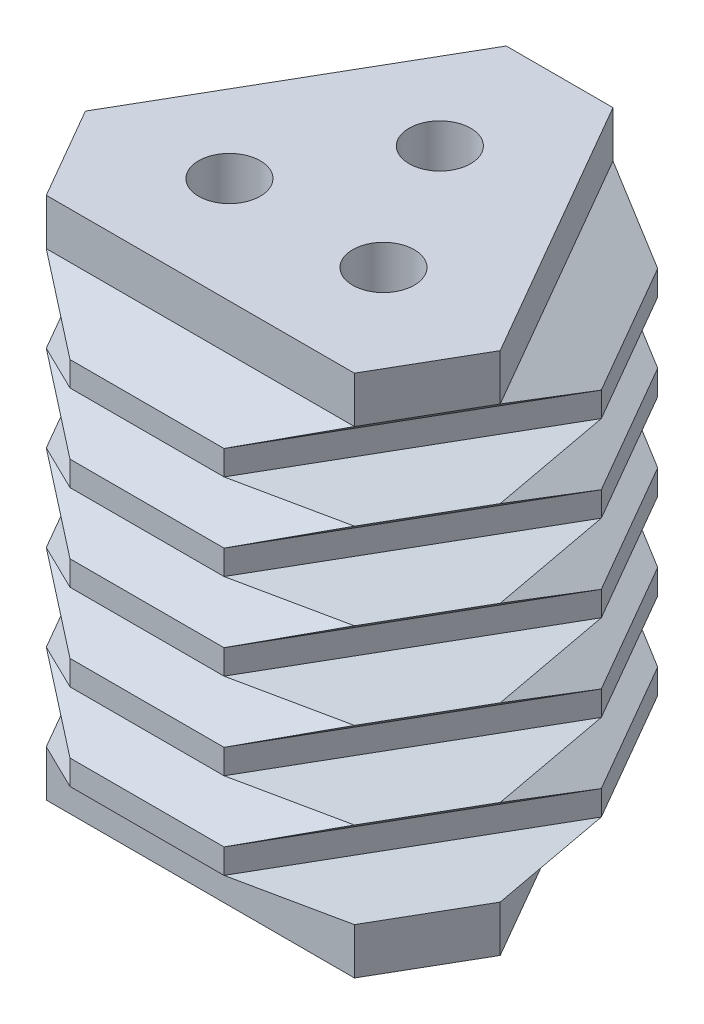
from build123d import *

# Parameters (mm, degrees)
SKETCH19_W           = 5
SKETCH19_H           = 2
BOSS_EXTRUDE2_DEPTH  = 0.8
SKETCH47_W           = 2
SKETCH47_H           = 0.8
BOSS_EXTRUDE11_DEPTH = 5
CUT_EXTRUDE4_DEPTH   = 9.488141412
BOSS_EXTRUDE14_DEPTH = 4.999998
CUT_EXTRUDE6_DEPTH   = 10.673887245
CIRPATTERN4_COUNT    = 3
BOSS_EXTRUDE15_DEPTH = 1
CIRPATTERN5_COUNT    = 3
LPATTERN1_COUNT      = 5
LPATTERN1_PITCH      = 2.8
SKETCH68_R           = 1
BOSS_EXTRUDE16_DEPTH = 1.5
BOSS_EXTRUDE17_DEPTH = 1.5


# Read off the part's stored shape, not the designer's step: Mirror4
with BuildPart() as part:
    # Sketch16 → Loft2 section 0
    with BuildSketch(Plane(origin=(0, 0, 0), x_dir=(1, 0, 0), z_dir=(0, 1, 0))):
        with BuildLine():
            Line((-5, -2.886751346), (5, -2.886751346))
            Line((5, -2.886751346), (5, -4.886751346))
            Line((5, -4.886751346), (-5, -4.886751346))
            Line((-5, -4.886751346), (-5, -2.886751346))
        make_face()
    # Sketch18 → Loft2 section 1
    with BuildSketch(Plane(origin=(0, 1, 0), x_dir=(1, 0, 0), z_dir=(0, 1, 0))):
        with BuildLine():
            Line((2.5, -6.618802154), (-2.5, -6.618802154))
            Line((-2.5, -6.618802154), (-2.5, -4.618802154))
            Line((-2.5, -4.618802154), (2.5, -4.618802154))
            Line((2.5, -4.618802154), (2.5, -6.618802154))
        make_face()
    loft()

    # Sketch19 → Boss-Extrude2 (add)
    with BuildSketch(Plane(origin=(0, 1, 0), x_dir=(1, 0, 0), z_dir=(0, 1, 0))):
        with Locations((0, -5.618802154)):
            Rectangle(SKETCH19_W, SKETCH19_H)
    extrude(amount=BOSS_EXTRUDE2_DEPTH)

    # Sketch47 → Boss-Extrude11 (add, along a direction that is not the sketch's normal)
    with BuildSketch(Plane(origin=(2.5, 0, 0), x_dir=(0, 0, -1), z_dir=(1, 0, 0))):
        with Locations((-5.618802154, 1.4)):
            Rectangle(SKETCH47_W, SKETCH47_H)
    boss_extrude11 = extrude(amount=BOSS_EXTRUDE11_DEPTH, dir=(0.5000000000000042, 0, -0.8660254037844363))

    # Sketch63 → Cut-Extrude4 (cut, through all)
    with BuildSketch(Plane(origin=(0, 1.8, 0), x_dir=(1, 0, 0), z_dir=(0, 1, 0))):
        Polygon((5, -2.288675135), (4.133974596, -1.788675135), (5, -0.288675135), align=None)
    cut_extrude4 = extrude(amount=-CUT_EXTRUDE4_DEPTH, mode=Mode.SUBTRACT)

    # Sketch64 → Boss-Extrude14 (add)
    with BuildSketch(Plane(origin=(0.258974596, 0, -0.448557159), x_dir=(-0.8660254037844368, 0, -0.5000000000000033), z_dir=(0.5000000000000032, 0, -0.8660254037844367))):
        Polygon((-6.773502692, 0), (-5.474464586, 1), (-4.474464586, 1), (-5.773502692, 0), align=None)
    boss_extrude14 = extrude(amount=-BOSS_EXTRUDE14_DEPTH)

    # Sketch65 → Cut-Extrude6 (cut, through all)
    with BuildSketch(Plane(origin=(0, 0, 0), x_dir=(0, 0, -1), z_dir=(1, 0, 0))):
        Polygon((-7.268321206, 0), (-10.354264897, 1), (-6.618802154, 1), (-4.886751346, 0), align=None)
    cut_extrude6 = extrude(amount=CUT_EXTRUDE6_DEPTH, mode=Mode.SUBTRACT)

    # Mirror3: Boss-Extrude11, Cut-Extrude4, Boss-Extrude14, Cut-Extrude6 across plane
    add(boss_extrude11.mirror(Plane(origin=(0, 0, 0), x_dir=(0, 0, 1), z_dir=(1, 0, 0))))
    add(cut_extrude4.mirror(Plane(origin=(0, 0, 0), x_dir=(0, 0, 1), z_dir=(1, 0, 0))), mode=Mode.SUBTRACT)
    add(boss_extrude14.mirror(Plane(origin=(0, 0, 0), x_dir=(0, 0, 1), z_dir=(1, 0, 0))))
    add(cut_extrude6.mirror(Plane(origin=(0, 0, 0), x_dir=(0, 0, 1), z_dir=(1, 0, 0))), mode=Mode.SUBTRACT)

    # Mirror4: part across plane


with BuildPart() as part_1:
    add(part.part)
    add(part.part.mirror(Plane.ZX.offset(1.4)))


with BuildPart() as cirpattern4_1:
    # CirPattern4: pattern copy
    add(part_1.part.rotate(Axis((0, 0, 0), (0, 1, 0)), 1 * 360 / CIRPATTERN4_COUNT))


with BuildPart() as cirpattern4_2:
    # CirPattern4: pattern copy
    add(part_1.part.rotate(Axis((0, 0, 0), (0, 1, 0)), 2 * 360 / CIRPATTERN4_COUNT))


with BuildPart() as cirpattern4_1_1:
    add(cirpattern4_1.part)

    # Combine1: union part, CirPattern4_2
    add(part_1.part)
    add(cirpattern4_2.part)

    # Sketch66 → Boss-Extrude15 (add, symmetric)
    with BuildSketch(Plane(origin=(0, 0, 0), x_dir=(0, 0, -1), z_dir=(1, 0, 0))):
        Polygon((0, 0), (-2.886751346, 0), (-4.618802154, 1), (-4.618802154, 1.8), (-2.886751346, 2.8), (0, 2.8), align=None)
    boss_extrude15 = extrude(amount=BOSS_EXTRUDE15_DEPTH, both=True)

    # CirPattern5: Boss-Extrude15 ×3 about axis
    cirpattern5_axis = Axis((0, 0, 0), (0, 1, 0))
    for i in range(1, CIRPATTERN5_COUNT):
        add(boss_extrude15.rotate(cirpattern5_axis, i * 360 / CIRPATTERN5_COUNT))


with BuildPart() as lpattern1_1:
    # LPattern1: pattern copy
    add(cirpattern4_1_1.part.moved(Location(Vector(0, -1, 0) * (1 * LPATTERN1_PITCH))))


with BuildPart() as lpattern1_2:
    # LPattern1: pattern copy
    add(cirpattern4_1_1.part.moved(Location(Vector(0, -1, 0) * (2 * LPATTERN1_PITCH))))


with BuildPart() as lpattern1_3:
    # LPattern1: pattern copy
    add(cirpattern4_1_1.part.moved(Location(Vector(0, -1, 0) * (3 * LPATTERN1_PITCH))))


with BuildPart() as lpattern1_4:
    # LPattern1: pattern copy
    add(cirpattern4_1_1.part.moved(Location(Vector(0, -1, 0) * (4 * LPATTERN1_PITCH))))


with BuildPart() as cirpattern4_1_2:
    add(cirpattern4_1_1.part)

    # Combine2: union LPattern1_1, LPattern1_2, LPattern1_3, LPattern1_4
    add(lpattern1_1.part)
    add(lpattern1_2.part)
    add(lpattern1_3.part)
    add(lpattern1_4.part)

    # Sketch68 → Boss-Extrude16 (add)
    with BuildSketch(Plane(origin=(0, 2.8, 0), x_dir=(1, 0, 0), z_dir=(0, 1, 0))):
        Polygon((-1.732050808, 6.773502692), (1.732050808, 6.773502692), (6.732050808, -1.886751346), (5, -4.886751346), (-5, -4.886751346), (-6.732050808, -1.886751346), align=None)
        with Locations(Location((0, 2.886751346, 0), (0, 0, 270))):
            Circle(SKETCH68_R, mode=Mode.SUBTRACT)
        with Locations(Location((2.5, -1.443375673, 0), (0, 0, 270))):
            Circle(SKETCH68_R, mode=Mode.SUBTRACT)
        with Locations(Location((-2.5, -1.443375673, 0), (0, 0, 270))):
            Circle(SKETCH68_R, mode=Mode.SUBTRACT)
    extrude(amount=BOSS_EXTRUDE16_DEPTH)

    # Sketch69 → Boss-Extrude17 (add)
    with BuildSketch(Plane.XZ.offset(11.2)):
        Polygon((-1.732050808, -6.773502692), (1.732050808, -6.773502692), (6.732050808, 1.886751346), (5, 4.886751346), (-5, 4.886751346), (-6.732050808, 1.886751346), align=None)
    extrude(amount=BOSS_EXTRUDE17_DEPTH)


solid = cirpattern4_1_2.part
